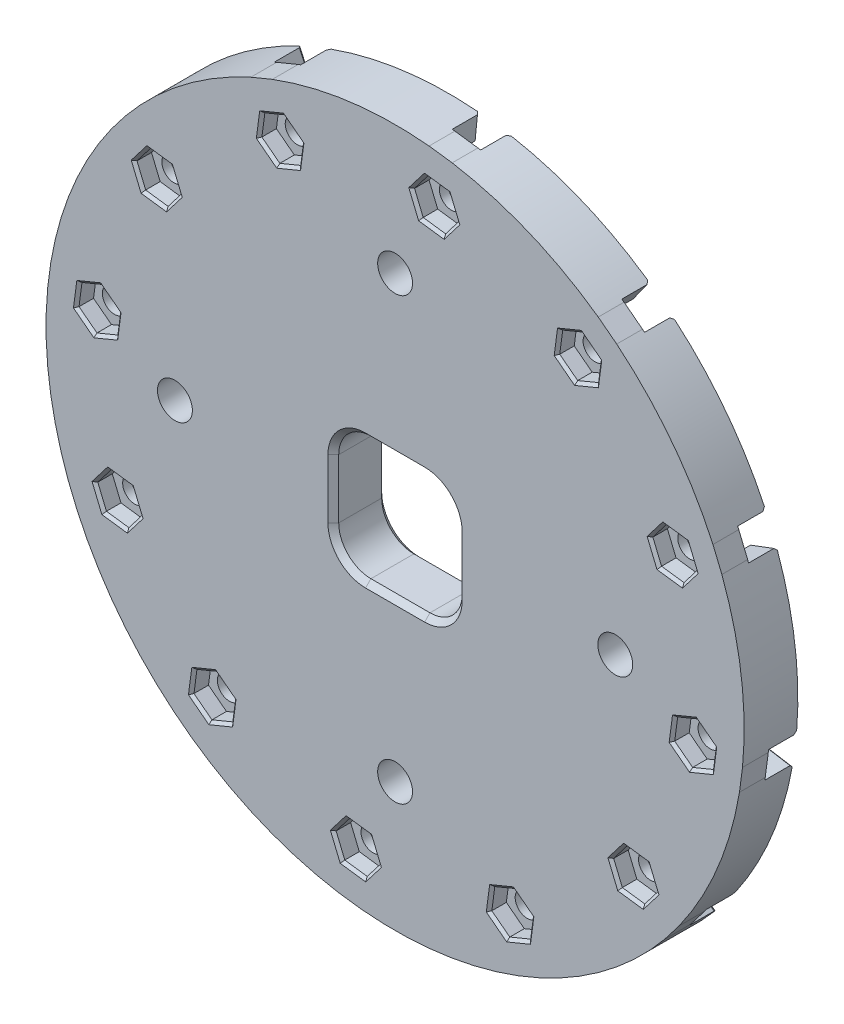
from build123d import *

# Parameters (mm, degrees)
SKETCH1_R                    = 216.5
SKETCH1_R_2                  = 3.25
SKETCH1_W                    = 10
SKETCH1_H                    = 10
SKETCH1_W_2                  = 23
SKETCH1_H_2                  = 23
BOSS_EXTRUDE1_DEPTH          = 10
CUT_EXTRUDE4_DEPTH           = 314.607238437
BOSS_EXTRUDE2_DEPTH          = 4.8
SKETCH5_R                    = 2.25
CUT_EXTRUDE5_DEPTH           = 93.466210045
CUT_EXTRUDE6_DEPTH           = 3.2
CHAMFER1_SIZE                = 0.5
CIRPATTERN1_COUNT            = 12
CHAMFER1_OF_CIRPATTERN1_SIZE = 0.5
CUT_EXTRUDE8_DEPTH           = 5.2
CHAMFER2_SIZE                = 0.5
CIRPATTERN2_COUNT            = 12
CHAMFER2_OF_CIRPATTERN2_SIZE = 0.5
FILLET_1_R                   = 6
CHAMFER3_SIZE                = 1


with BuildPart() as part:
    # Sketch1 → Boss-Extrude1 (new body)
    with BuildSketch(Plane.XY):
        Circle(SKETCH1_R)
        with Locations((0, 41)):
            Circle(SKETCH1_R_2, mode=Mode.SUBTRACT)
        with Locations((41, 0)):
            Circle(SKETCH1_R_2, mode=Mode.SUBTRACT)
        with Locations((0, -41)):
            Circle(SKETCH1_R_2, mode=Mode.SUBTRACT)
        with Locations((-41, 0)):
            Circle(SKETCH1_R_2, mode=Mode.SUBTRACT)
        with BuildLine():
            Line((-125.595447657, 5.905673219), (-58.266428742, 51.19536093))
            Line((-58.266428742, 51.19536093), (-92.372726141, 85.301658329))
            ThreePointArc((-92.372726141, 85.301658329), (-115.989059011, 48.534849729), (-125.595447657, 5.905673219))
        make_face(mode=Mode.SUBTRACT)
        with BuildLine():
            Line((-125.595447657, -5.905673219), (-58.266428742, -51.19536093))
            Line((-58.266428742, -51.19536093), (-92.372726141, -85.301658329))
            ThreePointArc((-92.372726141, -85.301658329), (-115.989059011, -48.534849729), (-125.595447657, -5.905673219))
        make_face(mode=Mode.SUBTRACT)
        with Locations((-107.5, 0)):
            Rectangle(SKETCH1_W, SKETCH1_H, mode=Mode.SUBTRACT)
        with BuildLine():
            Line((-5, 196.436376468), (-5, 145.634762102))
            ThreePointArc((-5, 145.634762102), (-55.764847121, 134.628250223), (-99.443793953, 106.514861765))
            Line((-99.443793953, 106.514861765), (-135.365959967, 142.437027778))
            ThreePointArc((-135.365959967, 142.437027778), (-75.19729446, 181.542328138), (-5, 196.436376468))
        make_face(mode=Mode.SUBTRACT)
        with BuildLine():
            Line((5, 196.436376468), (5, 145.634762102))
            ThreePointArc((5, 145.634762102), (55.764847121, 134.628250223), (99.443793953, 106.514861765))
            Line((99.443793953, 106.514861765), (135.365959967, 142.437027778))
            ThreePointArc((135.365959967, 142.437027778), (75.19729446, 181.542328138), (5, 196.436376468))
        make_face(mode=Mode.SUBTRACT)
        with BuildLine():
            Line((-5, -74.833147735), (-5, -125.634762102))
            ThreePointArc((-5, -125.634762102), (-48.116401916, -116.163270077), (-85.301658329, -92.372726141))
            Line((-85.301658329, -92.372726141), (-49.811562358, -56.882630169))
            Line((-49.811562358, -56.882630169), (-41.860465116, -62.231032936))
            ThreePointArc((-41.860465116, -62.231032936), (-24.262710526, -70.967040786), (-5, -74.833147735))
        make_face(mode=Mode.SUBTRACT)
        with BuildLine():
            Line((5, -74.833147735), (5, -125.634762102))
            ThreePointArc((5, -125.634762102), (48.116401916, -116.163270077), (85.301658329, -92.372726141))
            Line((85.301658329, -92.372726141), (49.379492315, -56.450560127))
            ThreePointArc((49.379492315, -56.450560127), (28.701257427, -69.290964938), (5, -74.833147735))
        make_face(mode=Mode.SUBTRACT)
        with BuildLine():
            Line((74.833147735, 5), (125.634762102, 5))
            ThreePointArc((125.634762102, 5), (116.163270077, 48.116401916), (92.372726141, 85.301658329))
            Line((92.372726141, 85.301658329), (56.450560127, 49.379492315))
            ThreePointArc((56.450560127, 49.379492315), (69.290964938, 28.701257427), (74.833147735, 5))
        make_face(mode=Mode.SUBTRACT)
        with BuildLine():
            Line((74.833147735, -5), (125.634762102, -5))
            ThreePointArc((125.634762102, -5), (116.163270077, -48.116401916), (92.372726141, -85.301658329))
            Line((92.372726141, -85.301658329), (56.450560127, -49.379492315))
            ThreePointArc((56.450560127, -49.379492315), (69.290964938, -28.701257427), (74.833147735, -5))
        make_face(mode=Mode.SUBTRACT)
        with BuildLine():
            Line((-142.437027778, 135.365959967), (-106.514861765, 99.443793953))
            ThreePointArc((-106.514861765, 99.443793953), (-134.628250223, 55.764847121), (-145.634762102, 5))
            Line((-145.634762102, 5), (-196.436376468, 5))
            ThreePointArc((-196.436376468, 5), (-181.542328138, 75.19729446), (-142.437027778, 135.365959967))
        make_face(mode=Mode.SUBTRACT)
        with BuildLine():
            Line((-49.811562358, 56.882630169), (-85.301658329, 92.372726141))
            ThreePointArc((-85.301658329, 92.372726141), (-48.116401916, 116.163270077), (-5, 125.634762102))
            Line((-5, 125.634762102), (-5, 74.833147735))
            ThreePointArc((-5, 74.833147735), (-24.262710526, 70.967040786), (-41.860465116, 62.231032936))
            Line((-41.860465116, 62.231032936), (-49.811562358, 56.882630169))
        make_face(mode=Mode.SUBTRACT)
        with BuildLine():
            Line((-135.365959967, -142.437027778), (-99.443793953, -106.514861765))
            ThreePointArc((-99.443793953, -106.514861765), (-55.764847121, -134.628250223), (-5, -145.634762102))
            Line((-5, -145.634762102), (-5, -196.436376468))
            ThreePointArc((-5, -196.436376468), (-75.19729446, -181.542328138), (-135.365959967, -142.437027778))
        make_face(mode=Mode.SUBTRACT)
        with BuildLine():
            Line((142.437027778, 135.365959967), (106.514861765, 99.443793953))
            ThreePointArc((106.514861765, 99.443793953), (134.628250223, 55.764847121), (145.634762102, 5))
            Line((145.634762102, 5), (196.436376468, 5))
            ThreePointArc((196.436376468, 5), (181.542328138, 75.19729446), (142.437027778, 135.365959967))
        make_face(mode=Mode.SUBTRACT)
        with BuildLine():
            Line((85.301658329, 92.372726141), (49.379492315, 56.450560127))
            ThreePointArc((49.379492315, 56.450560127), (28.701257427, 69.290964938), (5, 74.833147735))
            Line((5, 74.833147735), (5, 125.634762102))
            ThreePointArc((5, 125.634762102), (48.116401916, 116.163270077), (85.301658329, 92.372726141))
        make_face(mode=Mode.SUBTRACT)
        Rectangle(SKETCH1_W_2, SKETCH1_H_2, mode=Mode.SUBTRACT)
        with BuildLine():
            Line((145.634762102, -5), (196.436376468, -5))
            ThreePointArc((196.436376468, -5), (181.542328138, -75.19729446), (142.437027778, -135.365959967))
            Line((142.437027778, -135.365959967), (106.514861765, -99.443793953))
            ThreePointArc((106.514861765, -99.443793953), (134.628250223, -55.764847121), (145.634762102, -5))
        make_face(mode=Mode.SUBTRACT)
        with BuildLine():
            Line((-145.634762102, -5), (-196.436376468, -5))
            ThreePointArc((-196.436376468, -5), (-181.542328138, -75.19729446), (-142.437027778, -135.365959967))
            Line((-142.437027778, -135.365959967), (-106.514861765, -99.443793953))
            ThreePointArc((-106.514861765, -99.443793953), (-134.628250223, -55.764847121), (-145.634762102, -5))
        make_face(mode=Mode.SUBTRACT)
        with BuildLine():
            Line((5, -145.634762102), (5, -196.436376468))
            ThreePointArc((5, -196.436376468), (75.19729446, -181.542328138), (135.365959967, -142.437027778))
            Line((135.365959967, -142.437027778), (99.443793953, -106.514861765))
            ThreePointArc((99.443793953, -106.514861765), (55.764847121, -134.628250223), (5, -145.634762102))
        make_face(mode=Mode.SUBTRACT)
    extrude(amount=BOSS_EXTRUDE1_DEPTH)

    # Sketch3 → Revolve1 (revolve)
    with BuildSketch(Plane(origin=(0, 0, 0), x_dir=(1, 0, 0), z_dir=(0, 1, 0))):
        Polygon((-216.5, -10), (-221.5, -10), (-221.5, 5), (-211.5, 5), (-211.5, 2), (-216.5, 2), align=None)
    revolve(axis=Axis((0, 0, -88.392658446), (0, 0, 1)))

    # Sketch4 → Cut-Extrude4 (cut, through all)
    with BuildSketch(Plane.XY.offset(10)):
        Polygon((-210.343219142, -22.649065348), (-209.690588181, -27.606289655), (-204.733363874, -26.953658693), (-205.385994835, -21.996434387), (-201.91593782, -21.539592714), (-202.568568781, -16.582368407), (-214.465907118, -18.148682714), (-213.813276156, -23.10590702), align=None)
        Polygon((-137.324953493, -13.036028306), (-136.672322532, -17.993252612), (-131.715098225, -17.340621651), (-132.367729187, -12.383397344), (-128.897672172, -11.926555672), (-129.550303133, -6.969331365), (-141.447641469, -8.535645671), (-140.795010508, -13.492869978), align=None)
        with BuildLine():
            Line((-80.87496798, 105.3983103), (-83.918775125, 109.365077001))
            Line((-83.918775125, 109.365077001), (-125.70923509, 163.82746477))
            Line((-125.70923509, 163.82746477), (-128.753042235, 167.794231472))
            Line((-128.753042235, 167.794231472), (-134.840656525, 175.727764875))
            ThreePointArc((-134.840656525, 175.727764875), (-204.639316451, 84.764380269), (-219.605036794, -28.911551577))
            Line((-219.605036794, -28.911551577), (-209.690588181, -27.606289655))
            Line((-209.690588181, -27.606289655), (-210.343219142, -22.649065348))
            Line((-210.343219142, -22.649065348), (-213.813276156, -23.10590702))
            Line((-213.813276156, -23.10590702), (-214.465907118, -18.148682714))
            Line((-214.465907118, -18.148682714), (-202.568568781, -16.582368407))
            Line((-202.568568781, -16.582368407), (-201.91593782, -21.539592714))
            Line((-201.91593782, -21.539592714), (-205.385994835, -21.996434387))
            Line((-205.385994835, -21.996434387), (-204.733363874, -26.953658693))
            Line((-204.733363874, -26.953658693), (-136.672322532, -17.993252612))
            Line((-136.672322532, -17.993252612), (-137.324953493, -13.036028306))
            Line((-137.324953493, -13.036028306), (-140.795010508, -13.492869978))
            Line((-140.795010508, -13.492869978), (-141.447641469, -8.535645671))
            Line((-141.447641469, -8.535645671), (-129.550303133, -6.969331365))
            Line((-129.550303133, -6.969331365), (-128.897672172, -11.926555672))
            Line((-128.897672172, -11.926555672), (-132.367729187, -12.383397344))
            Line((-132.367729187, -12.383397344), (-131.715098225, -17.340621651))
            Line((-131.715098225, -17.340621651), (-64.443915989, -8.484202494))
            ThreePointArc((-64.443915989, -8.484202494), (-64.990959026, -1.084087146), (-64.691028143, 6.330156221))
            ThreePointArc((-64.691028143, 6.330156221), (-64.443915989, 8.484202494), (-64.125099801, 10.628808752))
            ThreePointArc((-64.125099801, 10.628808752), (-60.052169613, 24.874423104), (-52.858995658, 37.827590169))
            ThreePointArc((-52.858995658, 37.827590169), (-51.567967119, 39.569492886), (-50.219561072, 41.267368292))
            ThreePointArc((-50.219561072, 41.267368292), (-45.18898247, 46.722113215), (-39.569492886, 51.567967119))
            Line((-39.569492886, 51.567967119), (-80.87496798, 105.3983103))
        make_face()
        Polygon((-79.952008424, 112.408884146), (-83.918775125, 109.365077001), (-80.87496798, 105.3983103), (-76.908201279, 108.442117445), (-74.777536277, 105.665380754), (-70.810769576, 108.709187899), (-78.115906724, 118.229427982), (-82.082673425, 115.185620837), align=None)
        Polygon((-128.753042235, 167.794231472), (-125.70923509, 163.82746477), (-121.742468389, 166.871271915), (-119.611803387, 164.094535224), (-115.645036686, 167.138342369), (-122.950173834, 176.658582453), (-126.916940535, 173.614775308), (-124.786275534, 170.838038617), align=None)
        with BuildLine():
            Line((-125.70923509, 163.82746477), (-83.918775125, 109.365077001))
            Line((-83.918775125, 109.365077001), (-79.952008424, 112.408884146))
            Line((-79.952008424, 112.408884146), (-82.082673425, 115.185620837))
            Line((-82.082673425, 115.185620837), (-78.115906724, 118.229427982))
            Line((-78.115906724, 118.229427982), (-70.810769576, 108.709187899))
            Line((-70.810769576, 108.709187899), (-74.777536277, 105.665380754))
            Line((-74.777536277, 105.665380754), (-76.908201279, 108.442117445))
            Line((-76.908201279, 108.442117445), (-80.87496798, 105.3983103))
            Line((-80.87496798, 105.3983103), (-39.569492886, 51.567967119))
            ThreePointArc((-39.569492886, 51.567967119), (-33.434326521, 55.741777959), (-26.863437974, 59.18915188))
            ThreePointArc((-26.863437974, 59.18915188), (-24.874423104, 60.052169613), (-22.857731509, 60.848369824))
            ThreePointArc((-22.857731509, 60.848369824), (-8.484202494, 64.443915989), (6.330156221, 64.691028143))
            ThreePointArc((6.330156221, 64.691028143), (8.484202494, 64.443915989), (10.628808752, 64.125099801))
            ThreePointArc((10.628808752, 64.125099801), (17.868045728, 62.495863398), (24.874423104, 60.052169613))
            Line((24.874423104, 60.052169613), (50.840130245, 122.738931951))
            Line((50.840130245, 122.738931951), (52.753547407, 127.358329613))
            Line((52.753547407, 127.358329613), (79.024128783, 190.781123464))
            Line((79.024128783, 190.781123464), (80.937545945, 195.400521126))
            Line((80.937545945, 195.400521126), (84.764380269, 204.639316451))
            ThreePointArc((84.764380269, 204.639316451), (-28.911551577, 219.605036794), (-134.840656525, 175.727764875))
            Line((-134.840656525, 175.727764875), (-128.753042235, 167.794231472))
            Line((-128.753042235, 167.794231472), (-124.786275534, 170.838038617))
            Line((-124.786275534, 170.838038617), (-126.916940535, 173.614775308))
            Line((-126.916940535, 173.614775308), (-122.950173834, 176.658582453))
            Line((-122.950173834, 176.658582453), (-115.645036686, 167.138342369))
            Line((-115.645036686, 167.138342369), (-119.611803387, 164.094535224))
            Line((-119.611803387, 164.094535224), (-121.742468389, 166.871271915))
            Line((-121.742468389, 166.871271915), (-125.70923509, 163.82746477))
        make_face()
        Polygon((57.37294507, 125.444912452), (52.753547407, 127.358329613), (50.840130245, 122.738931951), (55.459527908, 120.825514789), (54.120135895, 117.591936425), (58.739533557, 115.678519263), (63.331734745, 126.765073654), (58.712337083, 128.678490815), align=None)
        Polygon((85.556943608, 193.487103964), (80.937545945, 195.400521126), (79.024128783, 190.781123464), (83.643526446, 188.867706302), (82.304134433, 185.634127938), (86.923532095, 183.720710776), (91.515733284, 194.807265166), (86.896335621, 196.720682328), align=None)
        with BuildLine():
            ThreePointArc((219.605036794, 28.911551577), (175.727764875, 134.840656525), (84.764380269, 204.639316451))
            Line((84.764380269, 204.639316451), (80.937545945, 195.400521126))
            Line((80.937545945, 195.400521126), (85.556943608, 193.487103964))
            Line((85.556943608, 193.487103964), (86.896335621, 196.720682328))
            Line((86.896335621, 196.720682328), (91.515733284, 194.807265166))
            Line((91.515733284, 194.807265166), (86.923532095, 183.720710776))
            Line((86.923532095, 183.720710776), (82.304134433, 185.634127938))
            Line((82.304134433, 185.634127938), (83.643526446, 188.867706302))
            Line((83.643526446, 188.867706302), (79.024128783, 190.781123464))
            Line((79.024128783, 190.781123464), (52.753547407, 127.358329613))
            Line((52.753547407, 127.358329613), (57.37294507, 125.444912452))
            Line((57.37294507, 125.444912452), (58.712337083, 128.678490815))
            Line((58.712337083, 128.678490815), (63.331734745, 126.765073654))
            Line((63.331734745, 126.765073654), (58.739533557, 115.678519263))
            Line((58.739533557, 115.678519263), (54.120135895, 117.591936425))
            Line((54.120135895, 117.591936425), (55.459527908, 120.825514789))
            Line((55.459527908, 120.825514789), (50.840130245, 122.738931951))
            Line((50.840130245, 122.738931951), (24.874423104, 60.052169613))
            ThreePointArc((24.874423104, 60.052169613), (31.556632504, 56.825865106), (37.827590169, 52.858995658))
            ThreePointArc((37.827590169, 52.858995658), (39.569492886, 51.567967119), (41.267368292, 50.219561072))
            ThreePointArc((41.267368292, 50.219561072), (51.567967119, 39.569492886), (59.18915188, 26.863437974))
            ThreePointArc((59.18915188, 26.863437974), (60.052169613, 24.874423104), (60.848369824, 22.857731509))
            ThreePointArc((60.848369824, 22.857731509), (63.057028198, 15.773750183), (64.443915989, 8.484202494))
            Line((64.443915989, 8.484202494), (131.715098225, 17.340621651))
            Line((131.715098225, 17.340621651), (136.672322532, 17.993252612))
            Line((136.672322532, 17.993252612), (204.733363874, 26.953658693))
            Line((204.733363874, 26.953658693), (209.690588181, 27.606289655))
            Line((209.690588181, 27.606289655), (219.605036794, 28.911551577))
        make_face()
        Polygon((137.324953493, 13.036028306), (136.672322532, 17.993252612), (131.715098225, 17.340621651), (132.367729187, 12.383397344), (128.897672172, 11.926555672), (129.550303133, 6.969331365), (141.447641469, 8.535645671), (140.795010508, 13.492869978), align=None)
        Polygon((210.343219142, 22.649065348), (209.690588181, 27.606289655), (204.733363874, 26.953658693), (205.385994835, 21.996434387), (201.91593782, 21.539592714), (202.568568781, 16.582368407), (214.465907118, 18.148682714), (213.813276156, 23.10590702), align=None)
        with BuildLine():
            ThreePointArc((221.5, 0), (221.025751497, 14.486793124), (219.605036794, 28.911551577))
            Line((219.605036794, 28.911551577), (209.690588181, 27.606289655))
            Line((209.690588181, 27.606289655), (210.343219142, 22.649065348))
            Line((210.343219142, 22.649065348), (213.813276156, 23.10590702))
            Line((213.813276156, 23.10590702), (214.465907118, 18.148682714))
            Line((214.465907118, 18.148682714), (202.568568781, 16.582368407))
            Line((202.568568781, 16.582368407), (201.91593782, 21.539592714))
            Line((201.91593782, 21.539592714), (205.385994835, 21.996434387))
            Line((205.385994835, 21.996434387), (204.733363874, 26.953658693))
            Line((204.733363874, 26.953658693), (136.672322532, 17.993252612))
            Line((136.672322532, 17.993252612), (137.324953493, 13.036028306))
            Line((137.324953493, 13.036028306), (140.795010508, 13.492869978))
            Line((140.795010508, 13.492869978), (141.447641469, 8.535645671))
            Line((141.447641469, 8.535645671), (129.550303133, 6.969331365))
            Line((129.550303133, 6.969331365), (128.897672172, 11.926555672))
            Line((128.897672172, 11.926555672), (132.367729187, 12.383397344))
            Line((132.367729187, 12.383397344), (131.715098225, 17.340621651))
            Line((131.715098225, 17.340621651), (64.443915989, 8.484202494))
            ThreePointArc((64.443915989, 8.484202494), (64.860830011, 4.2512034), (65, 0))
            ThreePointArc((65, 0), (64.922711085, -3.168846059), (64.691028143, -6.330156221))
            ThreePointArc((64.691028143, -6.330156221), (64.443915989, -8.484202494), (64.125099801, -10.628808752))
            ThreePointArc((64.125099801, -10.628808752), (60.052169613, -24.874423104), (52.858995658, -37.827590169))
            ThreePointArc((52.858995658, -37.827590169), (51.567967119, -39.569492886), (50.219561072, -41.267368292))
            ThreePointArc((50.219561072, -41.267368292), (45.18898247, -46.722113215), (39.569492886, -51.567967119))
            Line((39.569492886, -51.567967119), (80.87496798, -105.3983103))
            Line((80.87496798, -105.3983103), (83.918775125, -109.365077001))
            Line((83.918775125, -109.365077001), (125.70923509, -163.82746477))
            Line((125.70923509, -163.82746477), (128.753042235, -167.794231472))
            Line((128.753042235, -167.794231472), (134.840656525, -175.727764875))
            ThreePointArc((134.840656525, -175.727764875), (198.657312249, -97.966944884), (221.5, 0))
        make_face()
        Polygon((64.691028143, -6.330156221), (64.125099801, -10.628808752), (59.06071467, -9.789381115), (58.257205413, -14.637065606), (50.557145064, -12.702433011), (52.51938668, -0.863953047), (60.518304467, -0.995536637), (59.714795209, -5.843221127), align=None)
        Polygon((59.18915188, 26.863437974), (60.848369824, 22.857731509), (56.042769828, 21.052504602), (57.770752644, 16.452532055), (50.134988474, 14.277942855), (45.91509958, 25.511488053), (52.90815738, 29.396992216), (54.636140196, 24.797019668), align=None)
        Polygon((52.858995658, -37.827590169), (50.219561072, -41.267368292), (46.253388713, -38.008210068), (43.133687038, -41.804673358), (37.432555463, -36.279202209), (45.051146532, -27.007898627), (51.912620744, -31.121312251), (48.792919069, -34.917775541), align=None)
        with BuildLine():
            Line((-80.937545945, -195.400521126), (-84.764380269, -204.639316451))
            ThreePointArc((-84.764380269, -204.639316451), (28.911551577, -219.605036794), (134.840656525, -175.727764875))
            Line((134.840656525, -175.727764875), (128.753042235, -167.794231472))
            Line((128.753042235, -167.794231472), (124.786275534, -170.838038617))
            Line((124.786275534, -170.838038617), (126.916940535, -173.614775308))
            Line((126.916940535, -173.614775308), (122.950173834, -176.658582453))
            Line((122.950173834, -176.658582453), (115.645036686, -167.138342369))
            Line((115.645036686, -167.138342369), (119.611803387, -164.094535224))
            Line((119.611803387, -164.094535224), (121.742468389, -166.871271915))
            Line((121.742468389, -166.871271915), (125.70923509, -163.82746477))
            Line((125.70923509, -163.82746477), (83.918775125, -109.365077001))
            Line((83.918775125, -109.365077001), (79.952008424, -112.408884146))
            Line((79.952008424, -112.408884146), (82.082673425, -115.185620837))
            Line((82.082673425, -115.185620837), (78.115906724, -118.229427982))
            Line((78.115906724, -118.229427982), (70.810769576, -108.709187899))
            Line((70.810769576, -108.709187899), (74.777536277, -105.665380754))
            Line((74.777536277, -105.665380754), (76.908201279, -108.442117445))
            Line((76.908201279, -108.442117445), (80.87496798, -105.3983103))
            Line((80.87496798, -105.3983103), (39.569492886, -51.567967119))
            ThreePointArc((39.569492886, -51.567967119), (33.434326521, -55.741777959), (26.863437974, -59.18915188))
            ThreePointArc((26.863437974, -59.18915188), (24.874423104, -60.052169613), (22.857731509, -60.848369824))
            ThreePointArc((22.857731509, -60.848369824), (8.484202494, -64.443915989), (-6.330156221, -64.691028143))
            ThreePointArc((-6.330156221, -64.691028143), (-8.484202494, -64.443915989), (-10.628808752, -64.125099801))
            ThreePointArc((-10.628808752, -64.125099801), (-17.868045728, -62.495863398), (-24.874423104, -60.052169613))
            Line((-24.874423104, -60.052169613), (-50.840130245, -122.738931951))
            Line((-50.840130245, -122.738931951), (-52.753547407, -127.358329613))
            Line((-52.753547407, -127.358329613), (-79.024128783, -190.781123464))
            Line((-79.024128783, -190.781123464), (-80.937545945, -195.400521126))
        make_face()
        Polygon((79.952008424, -112.408884146), (83.918775125, -109.365077001), (80.87496798, -105.3983103), (76.908201279, -108.442117445), (74.777536277, -105.665380754), (70.810769576, -108.709187899), (78.115906724, -118.229427982), (82.082673425, -115.185620837), align=None)
        Polygon((124.786275534, -170.838038617), (128.753042235, -167.794231472), (125.70923509, -163.82746477), (121.742468389, -166.871271915), (119.611803387, -164.094535224), (115.645036686, -167.138342369), (122.950173834, -176.658582453), (126.916940535, -173.614775308), align=None)
        with BuildLine():
            Line((-209.690588181, -27.606289655), (-219.605036794, -28.911551577))
            ThreePointArc((-219.605036794, -28.911551577), (-175.727764875, -134.840656525), (-84.764380269, -204.639316451))
            Line((-84.764380269, -204.639316451), (-80.937545945, -195.400521126))
            Line((-80.937545945, -195.400521126), (-85.556943608, -193.487103964))
            Line((-85.556943608, -193.487103964), (-86.896335621, -196.720682328))
            Line((-86.896335621, -196.720682328), (-91.515733284, -194.807265166))
            Line((-91.515733284, -194.807265166), (-86.923532095, -183.720710776))
            Line((-86.923532095, -183.720710776), (-82.304134433, -185.634127938))
            Line((-82.304134433, -185.634127938), (-83.643526446, -188.867706302))
            Line((-83.643526446, -188.867706302), (-79.024128783, -190.781123464))
            Line((-79.024128783, -190.781123464), (-52.753547407, -127.358329613))
            Line((-52.753547407, -127.358329613), (-57.37294507, -125.444912452))
            Line((-57.37294507, -125.444912452), (-58.712337083, -128.678490815))
            Line((-58.712337083, -128.678490815), (-63.331734745, -126.765073654))
            Line((-63.331734745, -126.765073654), (-58.739533557, -115.678519263))
            Line((-58.739533557, -115.678519263), (-54.120135895, -117.591936425))
            Line((-54.120135895, -117.591936425), (-55.459527908, -120.825514789))
            Line((-55.459527908, -120.825514789), (-50.840130245, -122.738931951))
            Line((-50.840130245, -122.738931951), (-24.874423104, -60.052169613))
            ThreePointArc((-24.874423104, -60.052169613), (-31.556632504, -56.825865106), (-37.827590169, -52.858995658))
            ThreePointArc((-37.827590169, -52.858995658), (-39.569492886, -51.567967119), (-41.267368292, -50.219561072))
            ThreePointArc((-41.267368292, -50.219561072), (-51.567967119, -39.569492886), (-59.18915188, -26.863437974))
            ThreePointArc((-59.18915188, -26.863437974), (-60.052169613, -24.874423104), (-60.848369824, -22.857731509))
            ThreePointArc((-60.848369824, -22.857731509), (-63.057028198, -15.773750183), (-64.443915989, -8.484202494))
            Line((-64.443915989, -8.484202494), (-131.715098225, -17.340621651))
            Line((-131.715098225, -17.340621651), (-136.672322532, -17.993252612))
            Line((-136.672322532, -17.993252612), (-204.733363874, -26.953658693))
            Line((-204.733363874, -26.953658693), (-209.690588181, -27.606289655))
        make_face()
        Polygon((-57.37294507, -125.444912452), (-52.753547407, -127.358329613), (-50.840130245, -122.738931951), (-55.459527908, -120.825514789), (-54.120135895, -117.591936425), (-58.739533557, -115.678519263), (-63.331734745, -126.765073654), (-58.712337083, -128.678490815), align=None)
        Polygon((-85.556943608, -193.487103964), (-80.937545945, -195.400521126), (-79.024128783, -190.781123464), (-83.643526446, -188.867706302), (-82.304134433, -185.634127938), (-86.923532095, -183.720710776), (-91.515733284, -194.807265166), (-86.896335621, -196.720682328), align=None)
        Polygon((37.827590169, 52.858995658), (41.267368292, 50.219561072), (38.008210068, 46.253388713), (41.804673358, 43.133687038), (36.279202209, 37.432555463), (27.007898627, 45.051146532), (31.121312251, 51.912620744), (34.917775541, 48.792919069), align=None)
        Polygon((6.330156221, 64.691028143), (10.628808752, 64.125099801), (9.789381115, 59.06071467), (14.637065606, 58.257205413), (12.702433011, 50.557145064), (0.863953047, 52.51938668), (0.995536637, 60.518304467), (5.843221127, 59.714795209), align=None)
        Polygon((-26.863437974, 59.18915188), (-22.857731509, 60.848369824), (-21.052504602, 56.042769828), (-16.452532055, 57.770752644), (-14.277942855, 50.134988474), (-25.511488053, 45.91509958), (-29.396992216, 52.90815738), (-24.797019668, 54.636140196), align=None)
        Polygon((-52.858995658, 37.827590169), (-50.219561072, 41.267368292), (-46.253388713, 38.008210068), (-43.133687038, 41.804673358), (-37.432555463, 36.279202209), (-45.051146532, 27.007898627), (-51.912620744, 31.121312251), (-48.792919069, 34.917775541), align=None)
        Polygon((-64.691028143, 6.330156221), (-64.125099801, 10.628808752), (-59.06071467, 9.789381115), (-58.257205413, 14.637065606), (-50.557145064, 12.702433011), (-52.51938668, 0.863953047), (-60.518304467, 0.995536637), (-59.714795209, 5.843221127), align=None)
        Polygon((-59.18915188, -26.863437974), (-60.848369824, -22.857731509), (-56.042769828, -21.052504602), (-57.770752644, -16.452532055), (-50.134988474, -14.277942855), (-45.91509958, -25.511488053), (-52.90815738, -29.396992216), (-54.636140196, -24.797019668), align=None)
        Polygon((-37.827590169, -52.858995658), (-41.267368292, -50.219561072), (-38.008210068, -46.253388713), (-41.804673358, -43.133687038), (-36.279202209, -37.432555463), (-27.007898627, -45.051146532), (-31.121312251, -51.912620744), (-34.917775541, -48.792919069), align=None)
        Polygon((-6.330156221, -64.691028143), (-10.628808752, -64.125099801), (-9.789381115, -59.06071467), (-14.637065606, -58.257205413), (-12.702433011, -50.557145064), (-0.863953047, -52.51938668), (-0.995536637, -60.518304467), (-5.843221127, -59.714795209), align=None)
        Polygon((26.863437974, -59.18915188), (22.857731509, -60.848369824), (21.052504602, -56.042769828), (16.452532055, -57.770752644), (14.277942855, -50.134988474), (25.511488053, -45.91509958), (29.396992216, -52.90815738), (24.797019668, -54.636140196), align=None)
    extrude(amount=-CUT_EXTRUDE4_DEPTH, mode=Mode.SUBTRACT)


with BuildPart() as cut_extrude4_kept_piece:
    # of the separate pieces the step leaves, the one the design keeps (cut_extrude4_pieces_kept)
    add(part.part.solids().sort_by_distance((3.25, 41, 0))[0])

    # Sketch4<7> → Boss-Extrude2 (add)
    with BuildSketch(Plane.XY.offset(10)):
        Polygon((-59.18915188, -26.863437974), (-60.848369824, -22.857731509), (-56.042769828, -21.052504602), (-57.770752644, -16.452532055), (-50.134988474, -14.277942855), (-45.91509958, -25.511488053), (-52.90815738, -29.396992216), (-54.636140196, -24.797019668), align=None)
        Polygon((-37.827590169, -52.858995658), (-41.267368292, -50.219561072), (-38.008210068, -46.253388713), (-41.804673358, -43.133687038), (-36.279202209, -37.432555463), (-27.007898627, -45.051146532), (-31.121312251, -51.912620744), (-34.917775541, -48.792919069), align=None)
        Polygon((-6.330156221, -64.691028143), (-10.628808752, -64.125099801), (-9.789381115, -59.06071467), (-14.637065606, -58.257205413), (-12.702433011, -50.557145064), (-0.863953047, -52.51938668), (-0.995536637, -60.518304467), (-5.843221127, -59.714795209), align=None)
        Polygon((26.863437974, -59.18915188), (22.857731509, -60.848369824), (21.052504602, -56.042769828), (16.452532055, -57.770752644), (14.277942855, -50.134988474), (25.511488053, -45.91509958), (29.396992216, -52.90815738), (24.797019668, -54.636140196), align=None)
        Polygon((52.858995658, -37.827590169), (50.219561072, -41.267368292), (46.253388713, -38.008210068), (43.133687038, -41.804673358), (37.432555463, -36.279202209), (45.051146532, -27.007898627), (51.912620744, -31.121312251), (48.792919069, -34.917775541), align=None)
        Polygon((64.691028143, -6.330156221), (64.125099801, -10.628808752), (59.06071467, -9.789381115), (58.257205413, -14.637065606), (50.557145064, -12.702433011), (52.51938668, -0.863953047), (60.518304467, -0.995536637), (59.714795209, -5.843221127), align=None)
        Polygon((59.18915188, 26.863437974), (60.848369824, 22.857731509), (56.042769828, 21.052504602), (57.770752644, 16.452532055), (50.134988474, 14.277942855), (45.91509958, 25.511488053), (52.90815738, 29.396992216), (54.636140196, 24.797019668), align=None)
        Polygon((37.827590169, 52.858995658), (41.267368292, 50.219561072), (38.008210068, 46.253388713), (41.804673358, 43.133687038), (36.279202209, 37.432555463), (27.007898627, 45.051146532), (31.121312251, 51.912620744), (34.917775541, 48.792919069), align=None)
        Polygon((6.330156221, 64.691028143), (10.628808752, 64.125099801), (9.789381115, 59.06071467), (14.637065606, 58.257205413), (12.702433011, 50.557145064), (0.863953047, 52.51938668), (0.995536637, 60.518304467), (5.843221127, 59.714795209), align=None)
        Polygon((-26.863437974, 59.18915188), (-22.857731509, 60.848369824), (-21.052504602, 56.042769828), (-16.452532055, 57.770752644), (-14.277942855, 50.134988474), (-25.511488053, 45.91509958), (-29.396992216, 52.90815738), (-24.797019668, 54.636140196), align=None)
        Polygon((-52.858995658, 37.827590169), (-50.219561072, 41.267368292), (-46.253388713, 38.008210068), (-43.133687038, 41.804673358), (-37.432555463, 36.279202209), (-45.051146532, 27.007898627), (-51.912620744, 31.121312251), (-48.792919069, 34.917775541), align=None)
        Polygon((-64.691028143, 6.330156221), (-64.125099801, 10.628808752), (-59.06071467, 9.789381115), (-58.257205413, 14.637065606), (-50.557145064, 12.702433011), (-52.51938668, 0.863953047), (-60.518304467, 0.995536637), (-59.714795209, 5.843221127), align=None)
    extrude(amount=-BOSS_EXTRUDE2_DEPTH)

    # Sketch5 → Cut-Extrude5 (cut, through all)
    with BuildSketch(Plane(origin=(0, 0, 0), x_dir=(-1, 0, 0), z_dir=(0, 0, -1))):
        with Locations((-7.299747075, 55.463010406)):
            Circle(SKETCH5_R)
        with Locations((21.409738795, 51.682249519)):
            Circle(SKETCH5_R)
        with Locations((44.382502444, 34.053271611)):
            Circle(SKETCH5_R)
        with Locations((55.463010406, 7.299747075)):
            Circle(SKETCH5_R)
        with Locations((51.682249519, -21.409738795)):
            Circle(SKETCH5_R)
        with Locations((34.053271611, -44.382502444)):
            Circle(SKETCH5_R)
        with Locations((7.299747075, -55.463010406)):
            Circle(SKETCH5_R)
        with Locations((-21.409738795, -51.682249519)):
            Circle(SKETCH5_R)
        with Locations((-44.382502444, -34.053271611)):
            Circle(SKETCH5_R)
        with Locations((-55.463010406, -7.299747075)):
            Circle(SKETCH5_R)
        with Locations((-51.682249519, 21.409738795)):
            Circle(SKETCH5_R)
        with Locations((-34.053271611, 44.382502444)):
            Circle(SKETCH5_R)
    extrude(amount=-CUT_EXTRUDE5_DEPTH, mode=Mode.SUBTRACT)

    # Sketch6 → Cut-Extrude6 (cut)
    with BuildSketch(Plane.XY.offset(10)):
        Polygon((8.911729268, 51.568803588), (11.478220204, 54.911924526), (9.866238011, 58.806131344), (5.687764883, 59.357217224), (3.121273947, 56.014096286), (4.733256139, 52.119889468), align=None)
    cut_extrude6 = extrude(amount=-CUT_EXTRUDE6_DEPTH, mode=Mode.SUBTRACT)

    # Chamfer1
    chamfer1_edges = [cut_extrude4_kept_piece.edges().sort_by_distance(p)[0] for p in [
        (6.822492703, 51.844346528, 10),
        (10.194974736, 53.240364057, 10),
        (10.672229107, 56.859027935, 10),
        (7.777001447, 59.081674284, 10),
        (4.404519415, 57.685656755, 10),
        (3.927265043, 54.066992877, 10),
    ]]
    chamfer(chamfer1_edges, length=CHAMFER1_SIZE)

    # CirPattern1: Cut-Extrude6 ×12 about axis
    cirpattern1_axis = Axis((0, 0, 0), (0, 0, 1))
    for i in range(1, CIRPATTERN1_COUNT):
        add(cut_extrude6.rotate(cirpattern1_axis, i * 360 / CIRPATTERN1_COUNT), mode=Mode.SUBTRACT)

    # Chamfer1 of CirPattern1
    chamfer1_of_cirpattern1_edges = [cut_extrude4_kept_piece.edges().sort_by_distance(p)[0] for p in [
        (-20.013721265, 48.309767487, 10),
        (-17.791074916, 51.204995148, 10),
        (-19.187092446, 54.57747718, 10),
        (-22.805756324, 55.054731552, 10),
        (-25.028402673, 52.159503891, 10),
        (-23.632385144, 48.787021859, 10),
        (-41.487274784, 31.830625262, 10),
        (-41.010020412, 35.44928914, 10),
        (-43.905248073, 37.67193549, 10),
        (-47.277730105, 36.27591796, 10),
        (-47.754984477, 32.657254082, 10),
        (-44.859756816, 30.434607733, 10),
        (-51.844346528, 6.822492703, 10),
        (-53.240364057, 10.194974736, 10),
        (-56.859027935, 10.672229107, 10),
        (-59.081674284, 7.777001447, 10),
        (-57.685656755, 4.404519415, 10),
        (-54.066992877, 3.927265043, 10),
        (-48.309767487, -20.013721265, 10),
        (-51.204995148, -17.791074916, 10),
        (-54.57747718, -19.187092446, 10),
        (-55.054731552, -22.805756324, 10),
        (-52.159503891, -25.028402673, 10),
        (-48.787021859, -23.632385144, 10),
        (-31.830625262, -41.487274784, 10),
        (-35.44928914, -41.010020412, 10),
        (-37.67193549, -43.905248073, 10),
        (-36.27591796, -47.277730105, 10),
        (-32.657254082, -47.754984477, 10),
        (-30.434607733, -44.859756816, 10),
        (-6.822492703, -51.844346528, 10),
        (-10.194974736, -53.240364057, 10),
        (-10.672229107, -56.859027935, 10),
        (-7.777001447, -59.081674284, 10),
        (-4.404519415, -57.685656755, 10),
        (-3.927265043, -54.066992877, 10),
        (20.013721265, -48.309767487, 10),
        (17.791074916, -51.204995148, 10),
        (19.187092446, -54.57747718, 10),
        (22.805756324, -55.054731552, 10),
        (25.028402673, -52.159503891, 10),
        (23.632385144, -48.787021859, 10),
        (41.487274784, -31.830625262, 10),
        (41.010020412, -35.44928914, 10),
        (43.905248073, -37.67193549, 10),
        (47.277730105, -36.27591796, 10),
        (47.754984477, -32.657254082, 10),
        (44.859756816, -30.434607733, 10),
        (51.844346528, -6.822492703, 10),
        (53.240364057, -10.194974736, 10),
        (56.859027935, -10.672229107, 10),
        (59.081674284, -7.777001447, 10),
        (57.685656755, -4.404519415, 10),
        (54.066992877, -3.927265043, 10),
        (48.309767487, 20.013721265, 10),
        (51.204995148, 17.791074916, 10),
        (54.57747718, 19.187092446, 10),
        (55.054731552, 22.805756324, 10),
        (52.159503891, 25.028402673, 10),
        (48.787021859, 23.632385144, 10),
        (31.830625262, 41.487274784, 10),
        (35.44928914, 41.010020412, 10),
        (37.67193549, 43.905248073, 10),
        (36.27591796, 47.277730105, 10),
        (32.657254082, 47.754984477, 10),
        (30.434607733, 44.859756816, 10),
    ]]
    chamfer(chamfer1_of_cirpattern1_edges, length=CHAMFER1_OF_CIRPATTERN1_SIZE)

    # Sketch7 → Cut-Extrude8 (cut)
    with BuildSketch(Plane(origin=(0, 0, 0), x_dir=(-1, 0, 0), z_dir=(0, 0, -1))):
        Polygon((-34.82224015, 49.518582404), (-37.721836128, 53.570379795), (-41.981883762, 50.301530275), (-38.711955679, 46.322251734), (-42.541425798, 43.175427062), (-36.317656592, 36.753797814), (-26.357413138, 44.938517595), (-30.990671798, 52.667131275), align=None)
    cut_extrude8 = extrude(amount=-CUT_EXTRUDE8_DEPTH, mode=Mode.SUBTRACT)

    # Chamfer2
    chamfer2_edges = [cut_extrude4_kept_piece.edges().sort_by_distance(p)[0] for p in [
        (40.18220367, 48.111442852, 0),
        (40.626690739, 44.748839398, 0),
        (39.429541195, 39.964612438, 0),
        (31.337534865, 40.846157705, 0),
        (28.674042468, 48.802824435, 0),
        (32.906455974, 51.092856839, 0),
        (36.121051742, 51.333497813, 0),
    ]]
    chamfer(chamfer2_edges, length=CHAMFER2_SIZE)

    # CirPattern2: Cut-Extrude8 ×12 about axis
    cirpattern2_axis = Axis((0, 0, 0), (0, 0, 1))
    for i in range(1, CIRPATTERN2_COUNT):
        add(cut_extrude8.rotate(cirpattern2_axis, i * 360 / CIRPATTERN2_COUNT), mode=Mode.SUBTRACT)

    # Chamfer2 of CirPattern2
    chamfer2_of_cirpattern2_edges = [cut_extrude4_kept_piece.edges().sort_by_distance(p)[0] for p in [
        (10.743087733, 61.756833558, 0),
        (12.809326552, 59.066977078, 0),
        (14.164678116, 54.325140222, 0),
        (6.716022433, 51.042577652, 0),
        (0.431036989, 56.601506971, 0),
        (2.951398402, 60.700939962, 0),
        (5.614999514, 62.516639042, 0),
        (-21.574629887, 58.854530584, 0),
        (-18.440286339, 57.55816595, 0),
        (-14.895599026, 54.129290554, 0),
        (-19.705042787, 47.562180138, 0),
        (-27.927464503, 49.233861424, 0),
        (-27.794483988, 54.044255242, 0),
        (-26.3955873, 56.948497327, 0),
        (-48.111442852, 40.18220367, 0),
        (-44.748839398, 40.626690739, 0),
        (-39.964612438, 39.429541195, 0),
        (-40.846157705, 31.337534865, 0),
        (-48.802824435, 28.674042468, 0),
        (-51.092856839, 32.906455974, 0),
        (-51.333497813, 36.121051742, 0),
        (-61.756833558, 10.743087733, 0),
        (-59.066977078, 12.809326552, 0),
        (-54.325140222, 14.164678116, 0),
        (-51.042577652, 6.716022433, 0),
        (-56.601506971, 0.431036989, 0),
        (-60.700939962, 2.951398402, 0),
        (-62.516639042, 5.614999514, 0),
        (-58.854530584, -21.574629887, 0),
        (-57.55816595, -18.440286339, 0),
        (-54.129290554, -14.895599026, 0),
        (-47.562180138, -19.705042787, 0),
        (-49.233861424, -27.927464503, 0),
        (-54.044255242, -27.794483988, 0),
        (-56.948497327, -26.3955873, 0),
        (-40.18220367, -48.111442852, 0),
        (-40.626690739, -44.748839398, 0),
        (-39.429541195, -39.964612438, 0),
        (-31.337534865, -40.846157705, 0),
        (-28.674042468, -48.802824435, 0),
        (-32.906455974, -51.092856839, 0),
        (-36.121051742, -51.333497813, 0),
        (-10.743087733, -61.756833558, 0),
        (-12.809326552, -59.066977078, 0),
        (-14.164678116, -54.325140222, 0),
        (-6.716022433, -51.042577652, 0),
        (-0.431036989, -56.601506971, 0),
        (-2.951398402, -60.700939962, 0),
        (-5.614999514, -62.516639042, 0),
        (21.574629887, -58.854530584, 0),
        (18.440286339, -57.55816595, 0),
        (14.895599026, -54.129290554, 0),
        (19.705042787, -47.562180138, 0),
        (27.927464503, -49.233861424, 0),
        (27.794483988, -54.044255242, 0),
        (26.3955873, -56.948497327, 0),
        (48.111442852, -40.18220367, 0),
        (44.748839398, -40.626690739, 0),
        (39.964612438, -39.429541195, 0),
        (40.846157705, -31.337534865, 0),
        (48.802824435, -28.674042468, 0),
        (51.092856839, -32.906455974, 0),
        (51.333497813, -36.121051742, 0),
        (61.756833558, -10.743087733, 0),
        (59.066977078, -12.809326552, 0),
        (54.325140222, -14.164678116, 0),
        (51.042577652, -6.716022433, 0),
        (56.601506971, -0.431036989, 0),
        (60.700939962, -2.951398402, 0),
        (62.516639042, -5.614999514, 0),
        (58.854530584, 21.574629887, 0),
        (57.55816595, 18.440286339, 0),
        (54.129290554, 14.895599026, 0),
        (47.562180138, 19.705042787, 0),
        (49.233861424, 27.927464503, 0),
        (54.044255242, 27.794483988, 0),
        (56.948497327, 26.3955873, 0),
    ]]
    chamfer(chamfer2_of_cirpattern2_edges, length=CHAMFER2_OF_CIRPATTERN2_SIZE)

    # Скругление1
    fillet_1_edges = [cut_extrude4_kept_piece.edges().sort_by_distance(p)[0] for p in [
        (11.5, -11.5, 5),
        (-11.5, -11.5, 5),
        (-11.5, 11.5, 5),
        (11.5, 11.5, 5),
    ]]
    fillet(fillet_1_edges, radius=FILLET_1_R)

    # Chamfer3
    chamfer3_edges = [cut_extrude4_kept_piece.edges().sort_by_distance(p)[0] for p in [
        (0, -11.5, 0),
        (0, -11.5, 10),
        (11.5, 0, 0),
        (11.5, 0, 10),
        (-11.5, 0, 0),
        (-11.5, 0, 10),
        (0, 11.5, 0),
        (0, 11.5, 10),
        (9.742640687, -9.742640687, 0),
        (9.742640687, -9.742640687, 10),
        (-9.742640687, -9.742640687, 0),
        (-9.742640687, -9.742640687, 10),
        (9.742640687, 9.742640687, 0),
        (9.742640687, 9.742640687, 10),
        (-9.742640687, 9.742640687, 0),
        (-9.742640687, 9.742640687, 10),
    ]]
    chamfer(chamfer3_edges, length=CHAMFER3_SIZE)


solid = cut_extrude4_kept_piece.part
